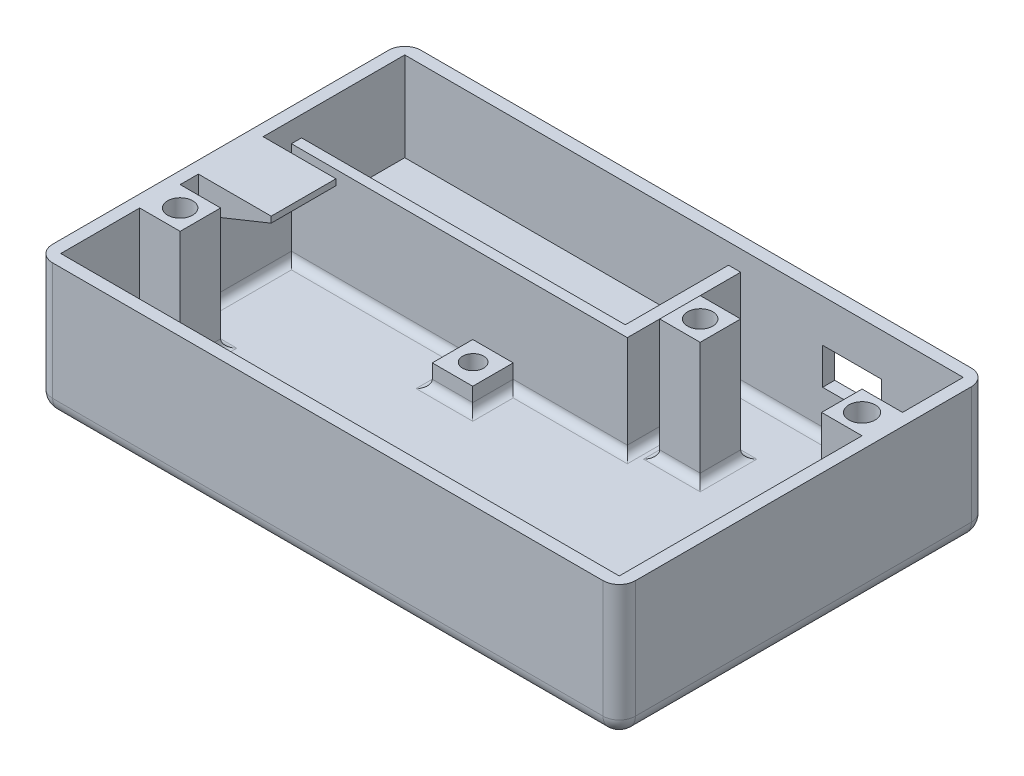
from build123d import *

# Parameters (mm, degrees)
CROQUIS1_W               = 138
CROQUIS1_H               = 85
SALIENTE_EXTRUIR1_DEPTH  = 3
CROQUIS3_W               = 144
CROQUIS3_H               = 91
CROQUIS3_W_2             = 138
CROQUIS3_H_2             = 85
SALIENTE_EXTRUIR3_DEPTH  = 3
CROQUIS7_W               = 144
CROQUIS7_H               = 91
CROQUIS7_W_2             = 138
CROQUIS7_H_2             = 85
SALIENTE_EXTRUIR4_DEPTH  = 30
CROQUIS8_W               = 10
CROQUIS8_H               = 10
SALIENTE_EXTRUIR5_DEPTH  = 5.5
CROQUIS9_W               = 16
CROQUIS9_H               = 1.5
SALIENTE_EXTRUIR6_DEPTH  = 18
SALIENTE_EXTRUIR7_DEPTH  = 16
CROQUIS11_W              = 83
CROQUIS11_H              = 28
SALIENTE_EXTRUIR8_DEPTH  = 8
SALIENTE_EXTRUIR9_DEPTH  = 17
CORTAR_EXTRUIR1_REACH    = 102.241
CROQUIS14_R              = 2.5
CORTAR_EXTRUIR2_REACH    = 90.626
CROQUIS15_R              = 2.6
CORTAR_EXTRUIR3_REACH    = 120.393
CROQUIS16_W              = 14.5
CROQUIS16_H              = 9
CROQUIS17_W              = 10
CROQUIS17_H              = 10
SALIENTE_EXTRUIR10_DEPTH = 30
CORTAR_EXTRUIR4_REACH    = 93.341
CROQUIS18_R              = 3.1
CROQUIS18_R_2            = 3.25
REDONDEO1_R              = 2
REDONDEO2_R              = 4
CORTAR_EXTRUIR5_REACH    = 90.626
CROQUIS21_R              = 2.6


with BuildPart() as part:
    # Croquis1 → Saliente-Extruir1 (new body)
    with BuildSketch(Plane(origin=(0, 0, 0), x_dir=(1, 0, 0), z_dir=(0, 1, 0))):
        Rectangle(CROQUIS1_W, CROQUIS1_H)
    extrude(amount=SALIENTE_EXTRUIR1_DEPTH)

    # Croquis3 → Saliente-Extruir3 (add)
    with BuildSketch(Plane(origin=(0, 3, 0), x_dir=(1, 0, 0), z_dir=(0, 1, 0))):
        Rectangle(CROQUIS3_W, CROQUIS3_H)
        Rectangle(CROQUIS3_W_2, CROQUIS3_H_2, mode=Mode.SUBTRACT)
    extrude(amount=-SALIENTE_EXTRUIR3_DEPTH)

    # Croquis7 → Saliente-Extruir4 (add)
    with BuildSketch(Plane(origin=(0, 3, 0), x_dir=(1, 0, 0), z_dir=(0, 1, 0))):
        Rectangle(CROQUIS7_W, CROQUIS7_H)
        Rectangle(CROQUIS7_W_2, CROQUIS7_H_2, mode=Mode.SUBTRACT)
    extrude(amount=SALIENTE_EXTRUIR4_DEPTH)

    # Croquis8 → Saliente-Extruir5 (add)
    with BuildSketch(Plane(origin=(0, 3, 0), x_dir=(1, 0, 0), z_dir=(0, 1, 0))):
        with Locations((-19.2, 9.5)):
            Rectangle(CROQUIS8_W, CROQUIS8_H)
        with Locations((31.5, -33.5)):
            Rectangle(CROQUIS8_W, CROQUIS8_H)
    extrude(amount=SALIENTE_EXTRUIR5_DEPTH)

    # Croquis9 → Saliente-Extruir6 (add)
    with BuildSketch(Plane(origin=(-69, 0, 0), x_dir=(0, 0, -1), z_dir=(1, 0, 0))):
        with Locations((-0.5, 32.25)):
            Rectangle(CROQUIS9_W, CROQUIS9_H)
    extrude(amount=SALIENTE_EXTRUIR6_DEPTH)

    # Croquis10 → Saliente-Extruir7 (add)
    with BuildSketch(Plane.XY.offset(8.5)):
        Polygon((-51, 31.5), (-69, 24.227527935), (-69, 33), (-51, 33), align=None)
    extrude(amount=-SALIENTE_EXTRUIR7_DEPTH)

    # Croquis11 → Saliente-Extruir8 (add)
    with BuildSketch(Plane(origin=(0, 3, 0), x_dir=(1, 0, 0), z_dir=(0, 1, 0))):
        with Locations((-27.5, 28.5)):
            Rectangle(CROQUIS11_W, CROQUIS11_H)
    extrude(amount=SALIENTE_EXTRUIR8_DEPTH)

    # Croquis12 → Saliente-Extruir9 (add)
    with BuildSketch(Plane(origin=(0, 11, 0), x_dir=(1, 0, 0), z_dir=(0, 1, 0))):
        Polygon((14, 42.5), (11, 42.5), (11, 17), (-69, 17), (-69, 14.5), (14, 14.5), align=None)
    extrude(amount=SALIENTE_EXTRUIR9_DEPTH)

    # Croquis14 → Cortar-Extruir1 (cut, up to next)
    with BuildSketch(Plane.ZY.offset(-11), mode=Mode.PRIVATE) as cortar_extruir1_sk1:
        with Locations(Location((-40, 15.5, 0), (0, 0, 180))):
            Circle(CROQUIS14_R)
    cortar_extruir1_tool1 = extrude(cortar_extruir1_sk1.sketch, amount=-CORTAR_EXTRUIR1_REACH, mode=Mode.PRIVATE) & part.part
    add(cortar_extruir1_tool1.solids().sort_by_distance((11, 15.5, -40))[0], mode=Mode.SUBTRACT)

    # Croquis15 → Cortar-Extruir2 (cut, up to next)
    with BuildSketch(Plane(origin=(0, 8.5, 0), x_dir=(1, 0, 0), z_dir=(0, 1, 0)), mode=Mode.PRIVATE) as cortar_extruir2_sk1:
        with Locations(Location((31.5, -33.5, 0), (0, 0, 270))):
            Circle(CROQUIS15_R)
    cortar_extruir2_tool1 = extrude(cortar_extruir2_sk1.sketch, amount=-CORTAR_EXTRUIR2_REACH, mode=Mode.PRIVATE) & part.part
    add(cortar_extruir2_tool1.solids().sort_by_distance((31.5, 8.5, 33.5))[0], mode=Mode.SUBTRACT)

    # Croquis16 → Cortar-Extruir3 (cut, up to next)
    with BuildSketch(Plane.XY.offset(-42.5), mode=Mode.PRIVATE) as cortar_extruir3_sk1:
        with Locations((41.5, 18)):
            Rectangle(CROQUIS16_W, CROQUIS16_H)
    cortar_extruir3_tool1 = extrude(cortar_extruir3_sk1.sketch, amount=-CORTAR_EXTRUIR3_REACH, mode=Mode.PRIVATE) & part.part
    add(cortar_extruir3_tool1.solids().sort_by_distance((41.5, 18, -42.5))[0], mode=Mode.SUBTRACT)

    # Croquis17 → Saliente-Extruir10 (add)
    with BuildSketch(Plane(origin=(0, 3, 0), x_dir=(1, 0, 0), z_dir=(0, 1, 0))):
        with Locations((-64, -18)):
            Rectangle(CROQUIS17_W, CROQUIS17_H)
        with Locations((64, 22.5)):
            Rectangle(CROQUIS17_W, CROQUIS17_H)
        with Locations((24, 22.5)):
            Rectangle(CROQUIS17_W, CROQUIS17_H)
    extrude(amount=SALIENTE_EXTRUIR10_DEPTH)

    # Croquis18 → Cortar-Extruir4 (cut, up to next)
    with BuildSketch(Plane(origin=(0, 33, 0), x_dir=(1, 0, 0), z_dir=(0, 1, 0)), mode=Mode.PRIVATE) as cortar_extruir4_sk1:
        with Locations(Location((-64, -18, 0), (0, 0, 270))):
            Circle(CROQUIS18_R)
    cortar_extruir4_tool1 = extrude(cortar_extruir4_sk1.sketch, amount=-CORTAR_EXTRUIR4_REACH, mode=Mode.PRIVATE) & part.part
    # Croquis18 → Cortar-Extruir4 (cut, up to next)
    with BuildSketch(Plane(origin=(0, 33, 0), x_dir=(1, 0, 0), z_dir=(0, 1, 0)), mode=Mode.PRIVATE) as cortar_extruir4_sk2:
        with Locations(Location((24, 22.5, 0), (0, 0, 270))):
            Circle(CROQUIS18_R)
    cortar_extruir4_tool2 = extrude(cortar_extruir4_sk2.sketch, amount=-CORTAR_EXTRUIR4_REACH, mode=Mode.PRIVATE) & part.part
    # Croquis18 → Cortar-Extruir4 (cut, up to next)
    with BuildSketch(Plane(origin=(0, 33, 0), x_dir=(1, 0, 0), z_dir=(0, 1, 0)), mode=Mode.PRIVATE) as cortar_extruir4_sk3:
        with Locations(Location((64, 22.5, 0), (0, 0, 270))):
            Circle(CROQUIS18_R_2)
    cortar_extruir4_tool3 = extrude(cortar_extruir4_sk3.sketch, amount=-CORTAR_EXTRUIR4_REACH, mode=Mode.PRIVATE) & part.part
    add(cortar_extruir4_tool1.solids().sort_by_distance((-64, 33, 18))[0], mode=Mode.SUBTRACT)
    add(cortar_extruir4_tool2.solids().sort_by_distance((24, 33, -22.5))[0], mode=Mode.SUBTRACT)
    add(cortar_extruir4_tool3.solids().sort_by_distance((64, 33, -22.5))[0], mode=Mode.SUBTRACT)

    # Redondeo1
    redondeo1_edges = [part.edges().sort_by_distance(p)[0] for p in [
        (-69, 3, -0.75),
        (-0.1, 3, -14.5),
        (-46.6, 3, -14.5),
        (14, 3, -28.5),
        (-69, 3, 32.75),
        (-64, 3, 23),
        (-59, 3, 18),
        (-64, 3, 13),
        (69, 3, -35),
        (64, 3, -27.5),
        (59, 3, -22.5),
        (64, 3, -17.5),
        (19, 3, -22.5),
        (24, 3, -17.5),
        (29, 3, -22.5),
        (24, 3, -27.5),
        (0, 3, 42.5),
        (69, 3, 12.5),
        (41.5, 3, -42.5),
        (-14.2, 3, -9.5),
        (-24.2, 3, -9.5),
        (-19.2, 3, -4.5),
        (36.5, 3, 33.5),
        (31.5, 3, 28.5),
        (26.5, 3, 33.5),
        (31.5, 3, 38.5),
    ]]
    fillet(redondeo1_edges, radius=REDONDEO1_R - 0.0001)  # a hair under: the kernel refuses the full size

    # Redondeo2
    redondeo2_edges = [part.edges().sort_by_distance(p)[0] for p in [
        (0, 0, 45.5),
        (72, 16.5, 45.5),
        (-72, 0, 0),
        (-72, 16.5, 45.5),
        (0, 0, -45.5),
        (-72, 16.5, -45.5),
        (72, 0, 0),
        (72, 16.5, -45.5),
    ]]
    fillet(redondeo2_edges, radius=REDONDEO2_R)

    # Croquis21 → Cortar-Extruir5 (cut, up to next)
    with BuildSketch(Plane(origin=(0, 8.5, 0), x_dir=(1, 0, 0), z_dir=(0, 1, 0)), mode=Mode.PRIVATE) as cortar_extruir5_sk1:
        with Locations(Location((-19.3, 9.7, 0), (0, 0, 270))):
            Circle(CROQUIS21_R)
    cortar_extruir5_tool1 = extrude(cortar_extruir5_sk1.sketch, amount=-CORTAR_EXTRUIR5_REACH, mode=Mode.PRIVATE) & part.part
    add(cortar_extruir5_tool1.solids().sort_by_distance((-19.3, 8.5, -9.7))[0], mode=Mode.SUBTRACT)


solid = part.part
